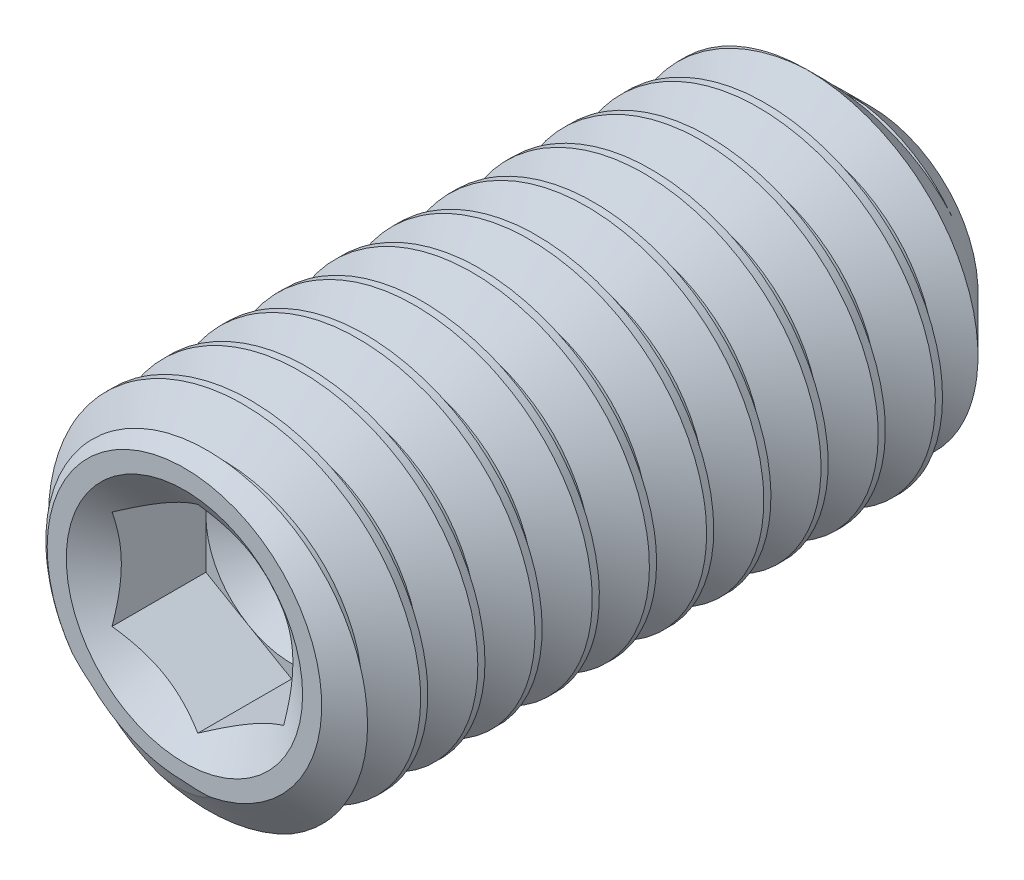
from build123d import *

# Parameters (mm, degrees)
CUT_EXTRUDE3_DEPTH = 0.9375
CUT_SWEEP1_PITCH   = 0.5


with BuildPart() as part:
    # Sketch4 → Revolve1 (revolve)
    with BuildSketch(Plane(origin=(0, 0, 0), x_dir=(0, 0, -1), z_dir=(1, 0, 0))):
        with BuildLine():
            Line((2.780834109, 0), (3.112041367, 0.551221444))
            ThreePointArc((3.112041367, 0.551221444), (3.191888731, 0.737071218), (3.219165891, 0.9375))
            Line((3.219165891, 0.9375), (2.656665891, 1.5))
            Line((2.656665891, 1.5), (-2.570771847, 1.5))
            Line((-2.570771847, 1.5), (-2.780834109, 1.2))
            Line((-2.780834109, 1.2), (-2.780834109, 0))
            Line((-2.780834109, 0), (2.780834109, 0))
        make_face()
    revolve(axis=Axis((0, 0, -2.780834109), (0, 0, 1)))

    # Sketch6 → Cut-Extrude3 (cut)
    with BuildSketch(Plane.XY.offset(2.780834109)):
        Polygon((0.75, 0.433012702), (0, 0.866025404), (-0.75, 0.433012702), (-0.75, -0.433012702), (0, -0.866025404), (0.75, -0.433012702), align=None)
    extrude(amount=-CUT_EXTRUDE3_DEPTH, mode=Mode.SUBTRACT)

    # Cut-Extrude4 cone 1 section (through the dimple's axis) → Cut-Extrude4 (revolve, cut)
    with BuildSketch(Plane(origin=(0, 0, 2.780834109), x_dir=(0, -1, 0), z_dir=(1, 0, 0))):
        Polygon((0, 0), (1.033012702, 0), (0, 0.723323281), align=None)
    revolve(axis=Axis((0, 0, 2.780834109), (0, 0, -1)), mode=Mode.SUBTRACT)

    # Cut-Extrude5 cone 1 section (through the dimple's axis) → Cut-Extrude5 (revolve, cut)
    with BuildSketch(Plane(origin=(0, 0, 1.843334109), x_dir=(0, -1, 0), z_dir=(1, 0, 0))):
        Polygon((0, 0), (0.75, 0), (0, 0.433012702), align=None)
    revolve(axis=Axis((0, 0, 1.843334109), (0, 0, -1)), mode=Mode.SUBTRACT)

    # Cut-Sweep1: the profile of Sketch10 profile screwed along a right-hand helix of 13 turns, 6 arcs to a turn; built about Z, then put on its axis
    cut_sweep1_z = Axis((0, 0, 0), (0, 0, 1))
    cut_sweep1_corners = [(1.5003, 0, 0.000173205), (1.5003, 0, -0.437673205), (1.175240474, 0, -0.25), (1.175240474, 0, -0.1875)]
    with BuildLine(mode=Mode.PRIVATE) as cut_sweep1_profile:
        Line(cut_sweep1_corners[0], cut_sweep1_corners[1])
        Line(cut_sweep1_corners[1], cut_sweep1_corners[2])
        Line(cut_sweep1_corners[2], cut_sweep1_corners[3])
        Line(cut_sweep1_corners[3], cut_sweep1_corners[0])
    cut_sweep1_cap = Face(cut_sweep1_profile.wire())
    cut_sweep1_turn_angles = [0, 30, 60, 90, 120, 150, 180, 210, 240, 270, 300, 330, 360]
    cut_sweep1_turn_weights = [1, 0.8660254037844387, 1, 0.8660254037844387, 1, 0.8660254037844387, 1, 0.8660254037844387, 1, 0.8660254037844387, 1, 0.8660254037844387, 1]
    cut_sweep1_turn_rails = [Edge.make_bspline([Vector(p[0], p[1], 0).rotate(cut_sweep1_z, cut_sweep1_turn_angles[k]) / cut_sweep1_turn_weights[k] + Vector(0, 0, p[2] + CUT_SWEEP1_PITCH * cut_sweep1_turn_angles[k] / 360) for k in range(13)], [0, 0, 0, 1, 1, 2, 2, 3, 3, 4, 4, 5, 5, 6, 6, 6], 2, cut_sweep1_turn_weights) for p in cut_sweep1_corners]
    cut_sweep1_turn_sides = [Face.make_surface_from_curves(cut_sweep1_turn_rails[p[0]], cut_sweep1_turn_rails[p[1]]) for p in [(0, 1), (1, 2), (2, 3), (3, 0)]]
    cut_sweep1 = Plane(origin=(0, 0, -3.219165891), x_dir=(0, 1, 0), z_dir=(0, 0, 1)) * Solid(Shell([*[p.moved(Location((0, 0, CUT_SWEEP1_PITCH * i))) for i in range(13) for p in cut_sweep1_turn_sides], cut_sweep1_cap, cut_sweep1_cap.rotate(cut_sweep1_z, 4680).moved(Location((0, 0, CUT_SWEEP1_PITCH * 4680 / 360)))]))
    add(cut_sweep1, mode=Mode.SUBTRACT)


solid = part.part
